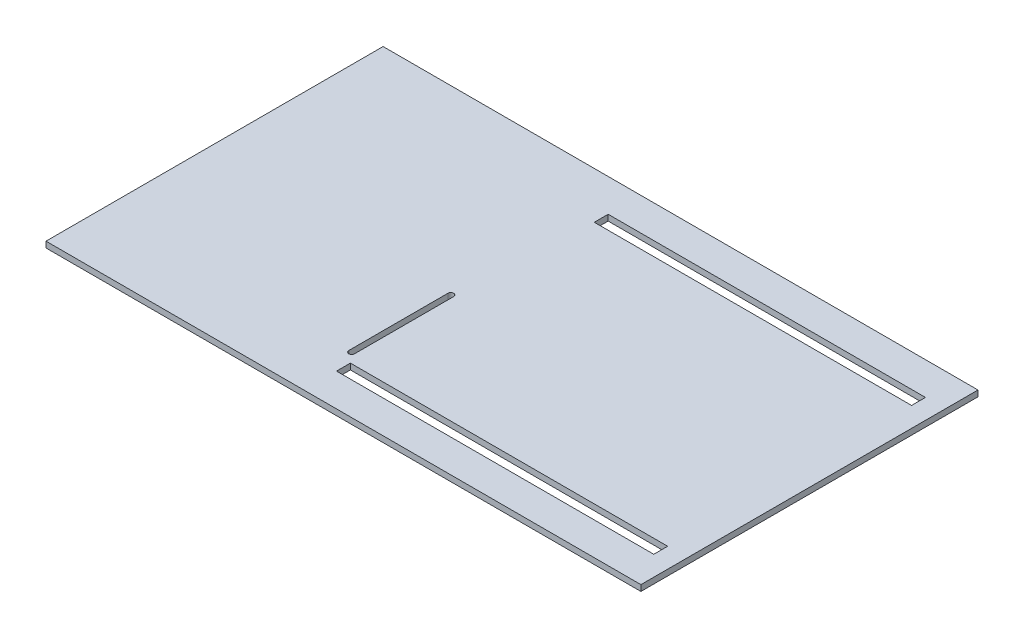
from build123d import *

# Parameters (mm, degrees)
SKETCH_1_W          = 300
SKETCH_1_H          = 170
EXTRUDE_1_DEPTH     = 3
CUT_EXTRUDE_1_DEPTH = 10
SKETCH_3_R          = 1.45
CUT_EXTRUDE_2_DEPTH = 10
SKETCH_4_W          = 160
SKETCH_4_H          = 7
CUT_EXTRUDE_3_DEPTH = 10


with BuildPart() as part:
    # 스케치1 → 보스-돌출1 (new body)
    with BuildSketch(Plane(origin=(0, 0, 0), x_dir=(1, 0, 0), z_dir=(0, 1, 0))):
        with Locations((150, 85)):
            Rectangle(SKETCH_1_W, SKETCH_1_H)
    extrude(amount=EXTRUDE_1_DEPTH)

    # 스케치2 → 컷-돌출1 (cut)
    with BuildSketch(Plane(origin=(0, 3, 0), x_dir=(1, 0, 0), z_dir=(0, 1, 0))):
        Polygon((124.1, 53.606579113), (124.1, 78.606579113), (127, 78.606579113), (127, 28.606579113), (124.1, 28.606579113), align=None)
    extrude(amount=-CUT_EXTRUDE_1_DEPTH, mode=Mode.SUBTRACT)

    # 스케치3 → 컷-돌출2 (cut)
    with BuildSketch(Plane(origin=(0, 3, 0), x_dir=(1, 0, 0), z_dir=(0, 1, 0))):
        with Locations((125.55, 78.606579113)):
            Circle(SKETCH_3_R)
        with Locations((125.55, 28.606579113)):
            Circle(SKETCH_3_R)
    extrude(amount=-CUT_EXTRUDE_2_DEPTH, mode=Mode.SUBTRACT)

    # 스케치4 → 컷-돌출3 (cut)
    with BuildSketch(Plane(origin=(0, 3, 0), x_dir=(1, 0, 0), z_dir=(0, 1, 0))):
        with Locations((210, 150)):
            Rectangle(SKETCH_4_W, SKETCH_4_H)
        with Locations((210, 20)):
            Rectangle(SKETCH_4_W, SKETCH_4_H)
    extrude(amount=-CUT_EXTRUDE_3_DEPTH, mode=Mode.SUBTRACT)


solid = part.part
